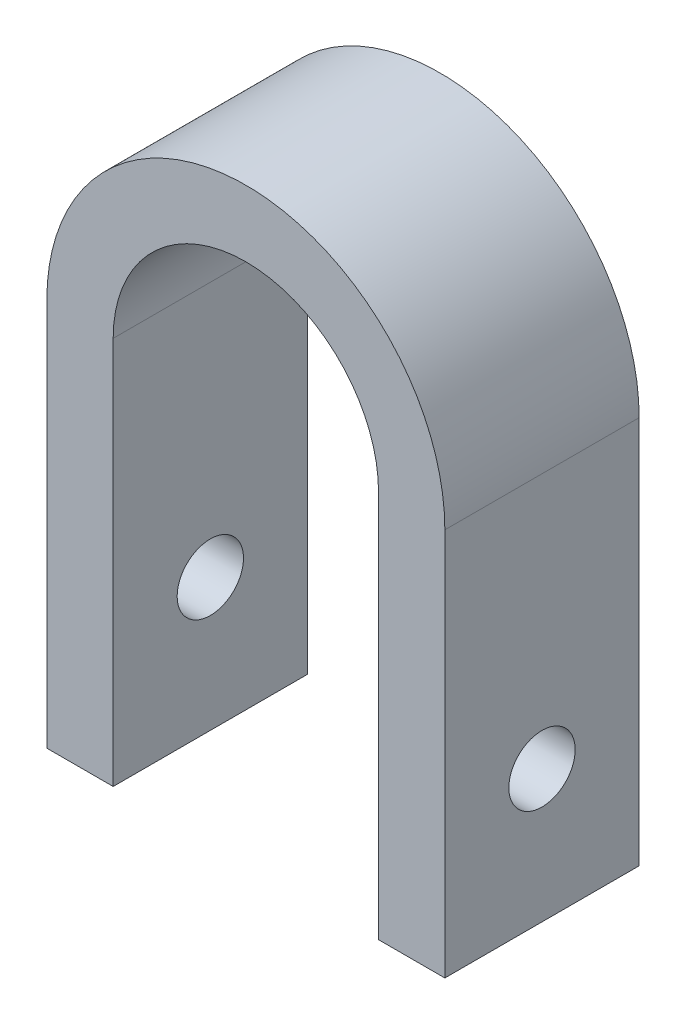
from build123d import *

# Parameters (mm, degrees)
BOSS_EXTRUDE1_DEPTH = 5.85813493
SKETCH2_R           = 1
CUT_EXTRUDE1_DEPTH  = 18.755096263


with BuildPart() as part:
    # Sketch1 → Boss-Extrude1 (new body)
    with BuildSketch(Plane.XY):
        with BuildLine():
            Line((-4, 0), (-4.000000001, -11.701525476))
            Line((-4.000000001, -11.701525476), (-6, -11.701525476))
            Line((-6, -11.701525476), (-6, 0))
            ThreePointArc((-6, 0), (0, 6), (6, 0))
            Line((6, 0), (6, -11.701525476))
            Line((6, -11.701525476), (3.999999999, -11.701525476))
            Line((3.999999999, -11.701525476), (4, 0))
            ThreePointArc((4, 0), (0, 4), (-4, 0))
        make_face()
    extrude(amount=BOSS_EXTRUDE1_DEPTH)

    # Sketch2 → Cut-Extrude1 (cut, through all)
    with BuildSketch(Plane.ZY.offset(6)):
        with Locations((2.929067465, -7.701525476)):
            Circle(SKETCH2_R)
    extrude(amount=-CUT_EXTRUDE1_DEPTH, mode=Mode.SUBTRACT)


solid = part.part
